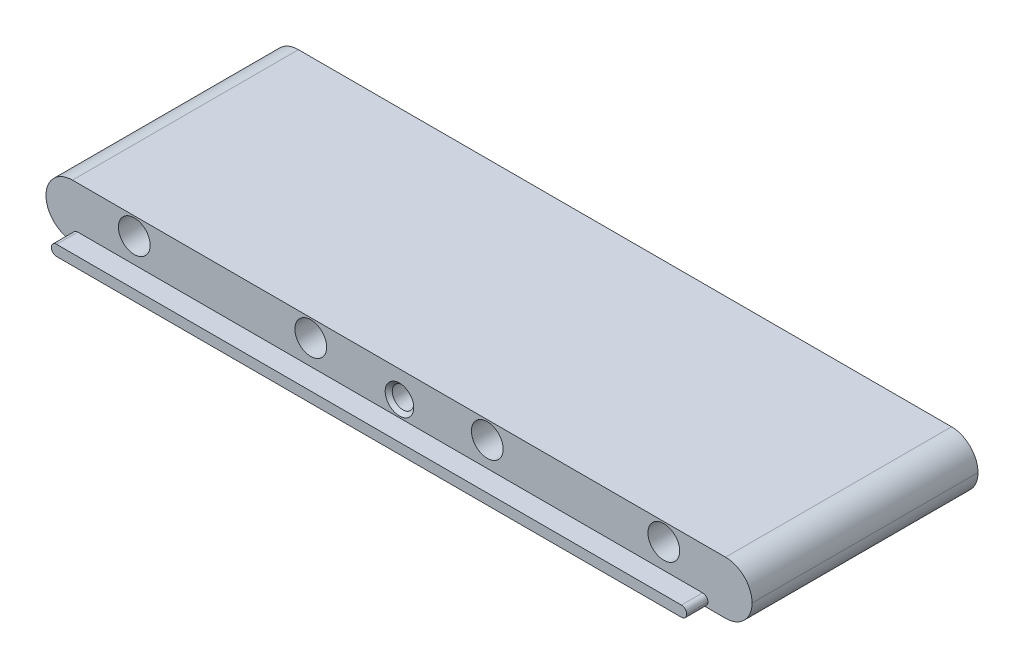
from build123d import *

# Parameters (mm, degrees)
SKETCH1_W           = 200
SKETCH1_H           = 15
SKETCH1_R           = 2.6
BOSS_EXTRUDE1_DEPTH = 64
SKETCH2_R           = 4.5
CUT_EXTRUDE1_DEPTH  = 57
FILLET3_R           = 7.5
SKETCH3_W           = 180
SKETCH3_H           = 3
BOSS_EXTRUDE2_DEPTH = 6
FILLET4_R           = 1.5
SKETCH4_R           = 3.05
CUT_EXTRUDE2_DEPTH  = 8
CHAMFER1_SIZE       = 1


with BuildPart() as part:
    # Sketch1 → Boss-Extrude1 (new body)
    with BuildSketch(Plane.XY):
        Rectangle(SKETCH1_W, SKETCH1_H)
        with Locations((75, 2.5)):
            Circle(SKETCH1_R, mode=Mode.SUBTRACT)
        with Locations((25, 2.5)):
            Circle(SKETCH1_R, mode=Mode.SUBTRACT)
        with Locations((-25, 2.5)):
            Circle(SKETCH1_R, mode=Mode.SUBTRACT)
        with Locations((-75, 2.5)):
            Circle(SKETCH1_R, mode=Mode.SUBTRACT)
    extrude(amount=BOSS_EXTRUDE1_DEPTH)

    # Sketch2 → Cut-Extrude1 (cut)
    with BuildSketch(Plane.XY.offset(64)):
        with Locations((-75, 2.5)):
            Circle(SKETCH2_R)
        with Locations((-25, 2.5)):
            Circle(SKETCH2_R)
        with Locations((25, 2.5)):
            Circle(SKETCH2_R)
        with Locations((75, 2.5)):
            Circle(SKETCH2_R)
    extrude(amount=-CUT_EXTRUDE1_DEPTH, mode=Mode.SUBTRACT)

    # Fillet3
    fillet3_edges = [part.edges().sort_by_distance(p)[0] for p in [
        (100, 7.5, 32),
        (100, -7.5, 32),
        (-100, 7.5, 32),
        (-100, -7.5, 32),
    ]]
    fillet(fillet3_edges, radius=FILLET3_R - 0.0001)  # a hair under: the kernel refuses the full size

    # Sketch3 → Boss-Extrude2 (add)
    with BuildSketch(Plane.XY.offset(64)):
        with Locations((-2.5, -6)):
            Rectangle(SKETCH3_W, SKETCH3_H)
    extrude(amount=BOSS_EXTRUDE2_DEPTH)

    # Fillet4
    fillet4_edges = [part.edges().sort_by_distance(p)[0] for p in [
        (87.5, -4.5, 67),
        (87.5, -7.5, 67),
        (-92.5, -7.5, 67),
        (-92.5, -4.5, 67),
    ]]
    fillet(fillet4_edges, radius=FILLET4_R - 0.0001)  # a hair under: the kernel refuses the full size

    # Sketch4 → Cut-Extrude2 (cut)
    with BuildSketch(Plane.XY.offset(64)):
        with Locations((0.125314072, 0)):
            Circle(SKETCH4_R)
    extrude(amount=-CUT_EXTRUDE2_DEPTH, mode=Mode.SUBTRACT)

    # Chamfer1
    chamfer1_edges = [part.edges().sort_by_distance(p)[0] for p in [
        (-2.924685928, 0, 64),
    ]]
    chamfer(chamfer1_edges, length=CHAMFER1_SIZE)


solid = part.part
